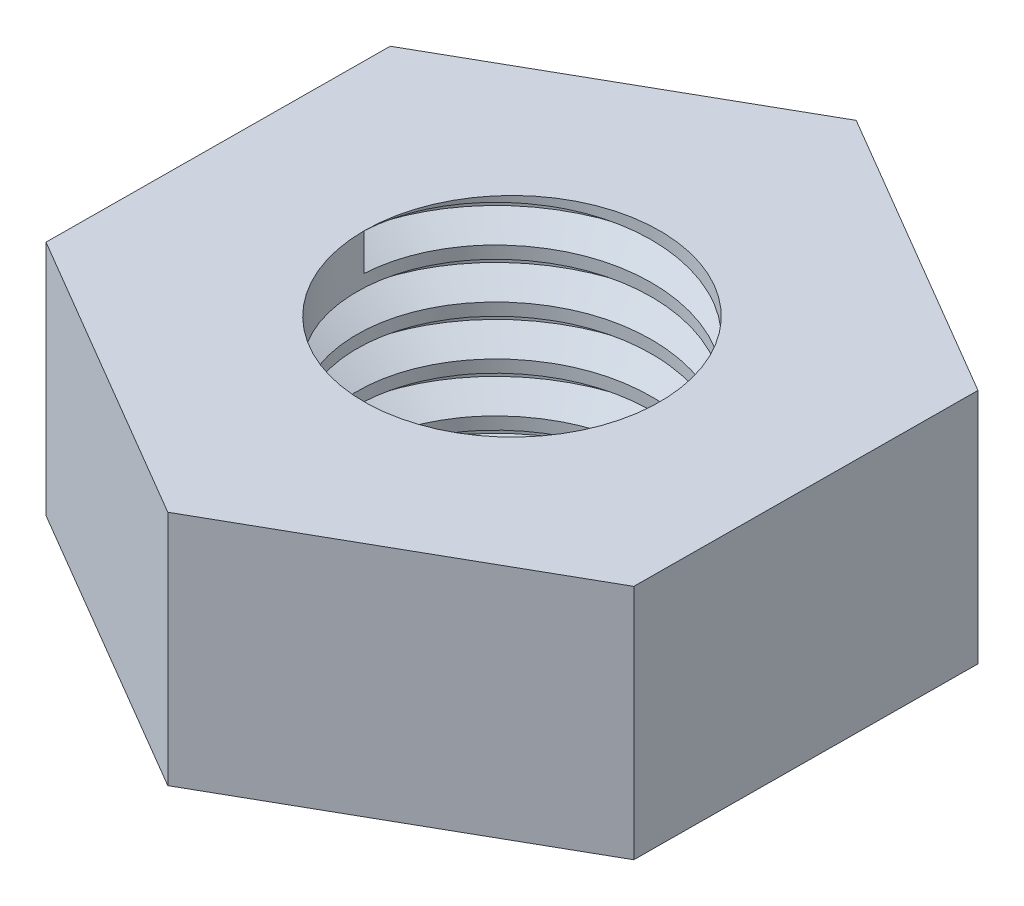
from build123d import *

# Parameters (mm, degrees)
BOSS_EXTRUDE1_DEPTH = 2.4
SKETCH2_R           = 1.5
CUT_EXTRUDE1_DEPTH  = 2.4
THREAD2_PITCH       = 0.5


with BuildPart() as part:
    # Sketch1 → Boss-Extrude1 (new body)
    with BuildSketch(Plane(origin=(0, 0, 0), x_dir=(1, 0, 0), z_dir=(0, 1, 0))):
        Polygon((3.012171301, 1.710796321), (0.024492575, 3.464015028), (-2.987678726, 1.753218706), (-3.012171301, -1.710796321), (-0.024492575, -3.464015028), (2.987678726, -1.753218706), align=None)
    extrude(amount=BOSS_EXTRUDE1_DEPTH)

    # Sketch2 → Cut-Extrude1 (cut)
    with BuildSketch(Plane(origin=(0, 2.4, 0), x_dir=(1, 0, 0), z_dir=(0, 1, 0))):
        with Locations(Location((0, 0, 0), (0, 0, 270))):
            Circle(SKETCH2_R)
    extrude(amount=-CUT_EXTRUDE1_DEPTH, mode=Mode.SUBTRACT)

    # Thread2: the profile of Thread Profile2 profile screwed along a right-hand helix of 4.8 turns, 6 arcs to a turn; built about Z, then put on its axis
    thread2_z = Axis((0, 0, 0), (0, 0, 1))
    thread2_corners = [(1.4997, 0, -0.000173205), (1.770632938, 0, 0.156249999), (1.770632938, 0, 0.218749999), (1.4997, 0, 0.375173204)]
    with BuildLine(mode=Mode.PRIVATE) as thread2_profile:
        Line(thread2_corners[0], thread2_corners[1])
        Line(thread2_corners[1], thread2_corners[2])
        Line(thread2_corners[2], thread2_corners[3])
        Line(thread2_corners[3], thread2_corners[0])
    thread2_cap = Face(thread2_profile.wire())
    thread2_turn_angles = [0, 30, 60, 90, 120, 150, 180, 210, 240, 270, 300, 330, 360]
    thread2_turn_weights = [1, 0.8660254037844387, 1, 0.8660254037844387, 1, 0.8660254037844387, 1, 0.8660254037844387, 1, 0.8660254037844387, 1, 0.8660254037844387, 1]
    thread2_turn_rails = [Edge.make_bspline([Vector(p[0], p[1], 0).rotate(thread2_z, thread2_turn_angles[k]) / thread2_turn_weights[k] + Vector(0, 0, p[2] + THREAD2_PITCH * thread2_turn_angles[k] / 360) for k in range(13)], [0, 0, 0, 1, 1, 2, 2, 3, 3, 4, 4, 5, 5, 6, 6, 6], 2, thread2_turn_weights) for p in thread2_corners]
    thread2_turn_sides = [Face.make_surface_from_curves(thread2_turn_rails[p[0]], thread2_turn_rails[p[1]]) for p in [(0, 1), (1, 2), (2, 3), (3, 0)]]
    thread2_last_angles = [1440, 1470, 1500, 1530, 1560, 1590, 1620, 1650, 1680, 1704, 1728]
    thread2_last_weights = [1, 0.8660254037844387, 1, 0.8660254037844387, 1, 0.8660254037844387, 1, 0.8660254037844387, 1, 0.9135454576426009, 1]
    thread2_last_rails = [Edge.make_bspline([Vector(p[0], p[1], 0).rotate(thread2_z, thread2_last_angles[k]) / thread2_last_weights[k] + Vector(0, 0, p[2] + THREAD2_PITCH * thread2_last_angles[k] / 360) for k in range(11)], [0, 0, 0, 1, 1, 2, 2, 3, 3, 4, 4, 5, 5, 5], 2, thread2_last_weights) for p in thread2_corners]
    thread2_last_sides = [Face.make_surface_from_curves(thread2_last_rails[p[0]], thread2_last_rails[p[1]]) for p in [(0, 1), (1, 2), (2, 3), (3, 0)]]
    thread2 = Plane(origin=(0, 2.4, 0), x_dir=(-1, 0, 0), z_dir=(0, -1, 0)) * Solid(Shell([*[p.moved(Location((0, 0, THREAD2_PITCH * i))) for i in range(4) for p in thread2_turn_sides], *thread2_last_sides, thread2_cap, thread2_cap.rotate(thread2_z, 1728).moved(Location((0, 0, THREAD2_PITCH * 1728 / 360)))]))
    add(thread2, mode=Mode.SUBTRACT)


solid = part.part
